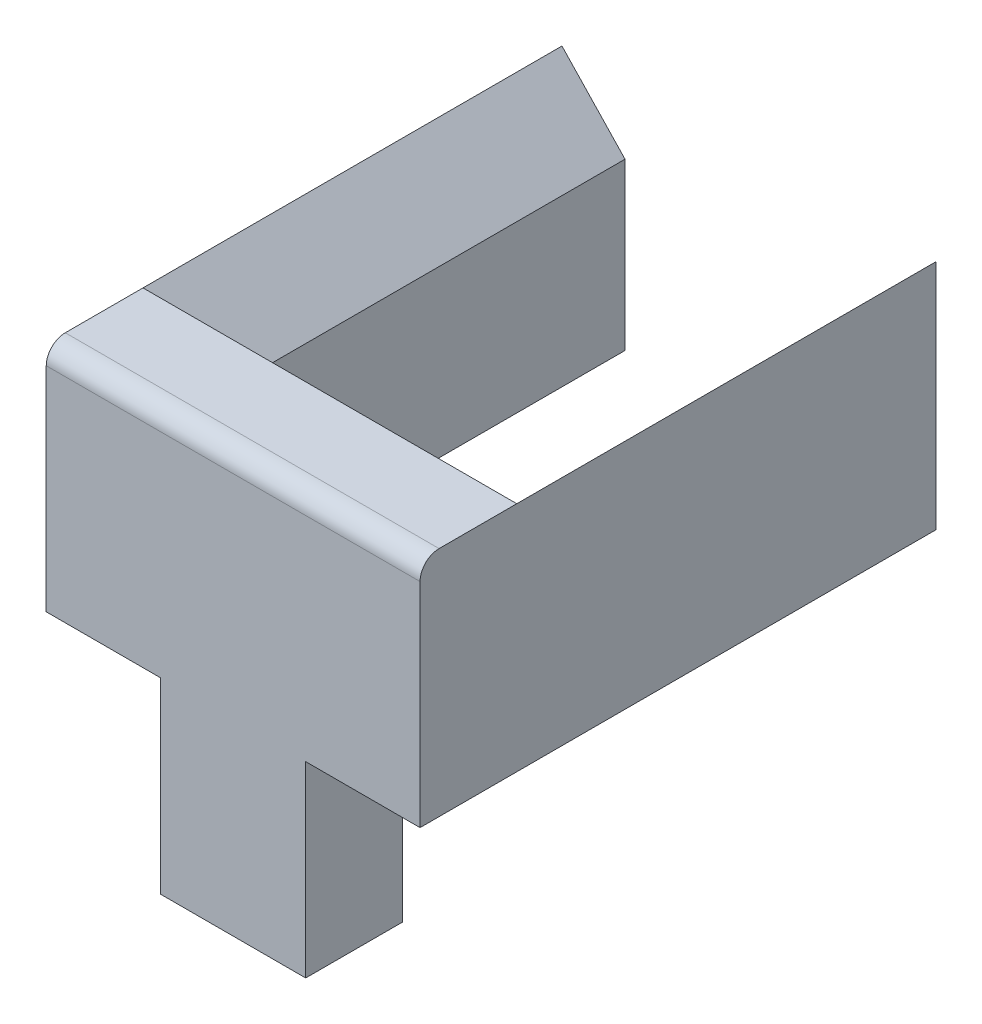
from build123d import *

# Parameters (mm, degrees)
SKETCH1_W           = 38.1
SKETCH1_H           = 25.4
BOSS_EXTRUDE1_DEPTH = 110.1598
SKETCH2_W           = 25.4
SKETCH2_H           = 60.96
BOSS_EXTRUDE2_DEPTH = 30.0228
SKETCH3_W           = 25.4
SKETCH3_H           = 60.96
BOSS_EXTRUDE3_DEPTH = 30.0228
BOSS_EXTRUDE4_DEPTH = 110.0074
CUT_EXTRUDE1_DEPTH  = 25.4
FILLET3_R           = 5


with BuildPart() as part:
    # Sketch1 → Boss-Extrude1 (new body)
    with BuildSketch(Plane(origin=(0, 0, 0), x_dir=(1, 0, 0), z_dir=(0, 1, 0))):
        with Locations((5.061883246, 0.142486096)):
            Rectangle(SKETCH1_W, SKETCH1_H)
    extrude(amount=BOSS_EXTRUDE1_DEPTH)

    # Sketch2 → Boss-Extrude2 (add)
    with BuildSketch(Plane(origin=(24.111883246, 0, 0), x_dir=(0, 0, -1), z_dir=(1, 0, 0))):
        with Locations((0.142486096, 79.6798)):
            Rectangle(SKETCH2_W, SKETCH2_H)
    extrude(amount=BOSS_EXTRUDE2_DEPTH)

    # Sketch3 → Boss-Extrude3 (add)
    with BuildSketch(Plane.ZY.offset(13.988116754)):
        with Locations((-0.142486096, 79.6798)):
            Rectangle(SKETCH3_W, SKETCH3_H)
    extrude(amount=BOSS_EXTRUDE3_DEPTH)

    # Sketch4 → Boss-Extrude4 (add)
    with BuildSketch(Plane(origin=(0, 0, -12.842486096), x_dir=(-1, 0, 0), z_dir=(0, 0, -1))):
        Polygon((-54.134683246, 110.1598), (-54.134683246, 49.1998), (-37.576683246, 49.1998), (-37.576683246, 92.699799868), align=None)
        Polygon((44.010916754, 110.1598), (44.010916754, 49.1998), (27.452916754, 49.1998), (27.452916754, 92.699799868), align=None)
    extrude(amount=BOSS_EXTRUDE4_DEPTH)

    # Sketch8 → Cut-Extrude1 (cut)
    with BuildSketch(Plane.XZ):
        Polygon((-9.983879826, -0.142486096), (-9.983879826, 7.477513904), (-4.938116754, 7.477513904), (-4.938116754, 3.667513904), (15.061883246, 3.667513904), (15.061883246, 7.477513904), (20.26528504, 7.477513904), (20.26528504, -7.782839921), (15.061883246, -7.782839921), (15.061883246, -3.960743278), (-4.938116754, -3.960743278), (-4.938116754, -7.782839921), (-9.983879826, -7.782839921), align=None)
    extrude(amount=-CUT_EXTRUDE1_DEPTH, mode=Mode.SUBTRACT)

    # Fillet3
    fillet3_edges = [part.edges().sort_by_distance(p)[0] for p in [
        (5.061883246, 110.1598, 12.557513904),
    ]]
    fillet(fillet3_edges, radius=FILLET3_R)


solid = part.part
